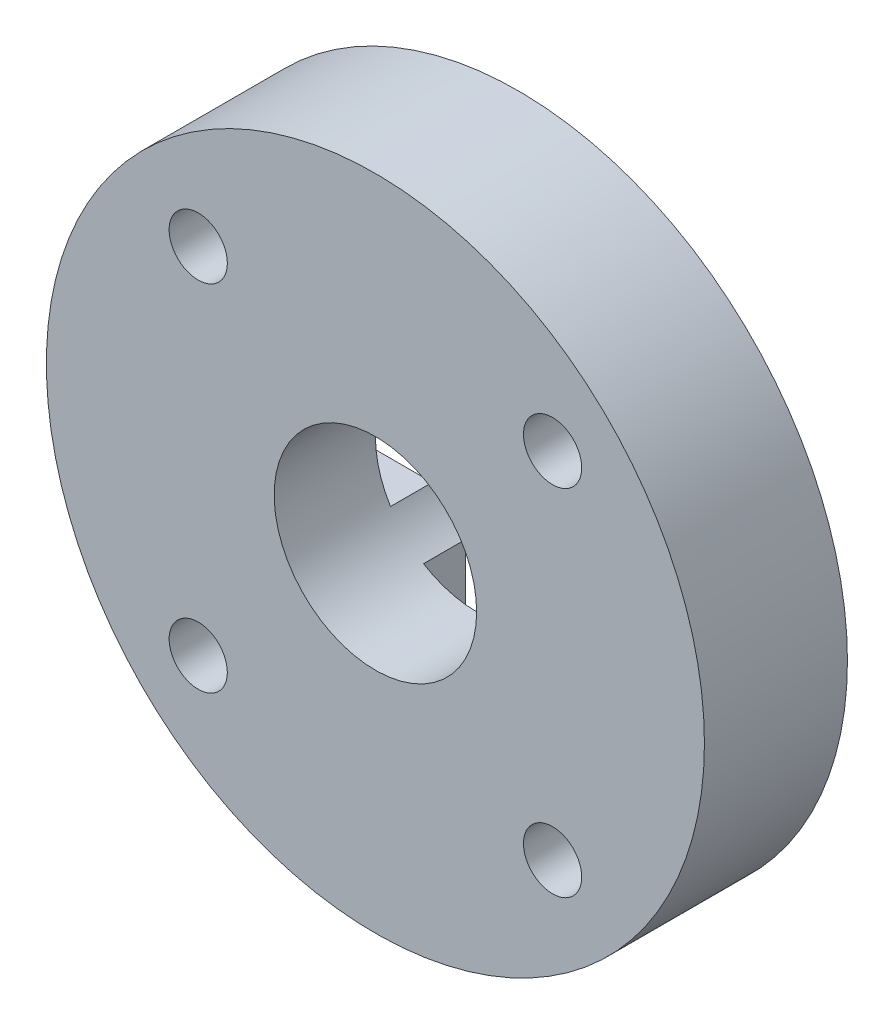
from build123d import *

# Parameters (mm, degrees)
TRIAL_LOAD_PLATE_PROFILE_R           = 13
TRIAL_LOAD_PLATE_PROFILE_R_2         = 4
TRIAL_LOAD_PLATE_DEPTH               = 4
CAPTURED_HORN_KEY_BOSS_START         = -1.65
CAPTURED_HORN_KEY_BOSS_PROFILE_R     = 13
CAPTURED_HORN_KEY_BOSS_DEPTH         = 1.65
KEY_POCKET_HUB_START                 = -1.65
STOCK_HORN_POCKET_HUB_R              = 3.55
KEY_POCKET_HUB_DEPTH                 = 1.65
KEY_POCKET_HORIZONTAL_START          = -1.65
STOCK_HORN_POCKET_HORIZONTAL_W       = 16.3
STOCK_HORN_POCKET_HORIZONTAL_H       = 4.2
KEY_POCKET_HORIZONTAL_DEPTH          = 1.65
KEY_POCKET_VERTICAL_START            = -1.65
STOCK_HORN_POCKET_VERTICAL_W         = 4.2
STOCK_HORN_POCKET_VERTICAL_H         = 16.3
KEY_POCKET_VERTICAL_DEPTH            = 1.65
KEY_POCKET_ROUNDED_TIPS_START        = -1.65
STOCK_HORN_POCKET_ROUNDED_TIPS_R     = 2.1
KEY_POCKET_ROUNDED_TIPS_DEPTH        = 1.65
UNMODIFIED_HORN_CAPTURE_M2_START     = -50
UNMODIFIED_HORN_CAPTURE_M2_PROFILE_R = 1.15
UNMODIFIED_HORN_CAPTURE_M2_DEPTH     = 69.814887722
HUB_CLEARANCE_IN_KEY_BOSS_ONLY_START = -1.65
HORN_CENTER_HUB_CLEARANCE_R          = 4
HUB_CLEARANCE_IN_KEY_BOSS_ONLY_DEPTH = 1.65


with BuildPart() as part:
    # Trial_load_plate_profile → Trial_load_plate (new body)
    with BuildSketch(Plane.XY):
        Circle(TRIAL_LOAD_PLATE_PROFILE_R)
        Circle(TRIAL_LOAD_PLATE_PROFILE_R_2, mode=Mode.SUBTRACT)
    extrude(amount=TRIAL_LOAD_PLATE_DEPTH)

    # Captured_horn_key_boss_profile → Captured_horn_key_boss (add)
    with BuildSketch(Plane.XY.offset(CAPTURED_HORN_KEY_BOSS_START)):
        Circle(CAPTURED_HORN_KEY_BOSS_PROFILE_R)
    extrude(amount=CAPTURED_HORN_KEY_BOSS_DEPTH)

    # Stock_horn_pocket_Hub → Key_pocket_Hub (cut)
    with BuildSketch(Plane.XY.offset(KEY_POCKET_HUB_START)):
        Circle(STOCK_HORN_POCKET_HUB_R)
    extrude(amount=KEY_POCKET_HUB_DEPTH, mode=Mode.SUBTRACT)

    # Stock_horn_pocket_Horizontal → Key_pocket_Horizontal (cut)
    with BuildSketch(Plane.XY.offset(KEY_POCKET_HORIZONTAL_START)):
        Rectangle(STOCK_HORN_POCKET_HORIZONTAL_W, STOCK_HORN_POCKET_HORIZONTAL_H)
    extrude(amount=KEY_POCKET_HORIZONTAL_DEPTH, mode=Mode.SUBTRACT)

    # Stock_horn_pocket_Vertical → Key_pocket_Vertical (cut)
    with BuildSketch(Plane.XY.offset(KEY_POCKET_VERTICAL_START)):
        Rectangle(STOCK_HORN_POCKET_VERTICAL_W, STOCK_HORN_POCKET_VERTICAL_H)
    extrude(amount=KEY_POCKET_VERTICAL_DEPTH, mode=Mode.SUBTRACT)

    # Stock_horn_pocket_Rounded_tips → Key_pocket_Rounded_tips (cut)
    with BuildSketch(Plane.XY.offset(KEY_POCKET_ROUNDED_TIPS_START)):
        with Locations((8.15, 0)):
            Circle(STOCK_HORN_POCKET_ROUNDED_TIPS_R)
        with Locations((-8.15, 0)):
            Circle(STOCK_HORN_POCKET_ROUNDED_TIPS_R)
        with Locations((0, 8.15)):
            Circle(STOCK_HORN_POCKET_ROUNDED_TIPS_R)
        with Locations((0, -8.15)):
            Circle(STOCK_HORN_POCKET_ROUNDED_TIPS_R)
    extrude(amount=KEY_POCKET_ROUNDED_TIPS_DEPTH, mode=Mode.SUBTRACT)

    # Unmodified_horn_capture_M2_profile → Unmodified_horn_capture_M2 (cut, through all)
    with BuildSketch(Plane.XY.offset(UNMODIFIED_HORN_CAPTURE_M2_START)):
        with Locations((7, 7)):
            Circle(UNMODIFIED_HORN_CAPTURE_M2_PROFILE_R)
        with Locations((-7, 7)):
            Circle(UNMODIFIED_HORN_CAPTURE_M2_PROFILE_R)
        with Locations((-7, -7)):
            Circle(UNMODIFIED_HORN_CAPTURE_M2_PROFILE_R)
        with Locations((7, -7)):
            Circle(UNMODIFIED_HORN_CAPTURE_M2_PROFILE_R)
    extrude(amount=UNMODIFIED_HORN_CAPTURE_M2_DEPTH, mode=Mode.SUBTRACT)

    # Horn_center_hub_clearance → Hub_clearance_in_key_boss_only (cut)
    with BuildSketch(Plane.XY.offset(HUB_CLEARANCE_IN_KEY_BOSS_ONLY_START)):
        Circle(HORN_CENTER_HUB_CLEARANCE_R)
    extrude(amount=HUB_CLEARANCE_IN_KEY_BOSS_ONLY_DEPTH, mode=Mode.SUBTRACT)


solid = part.part
